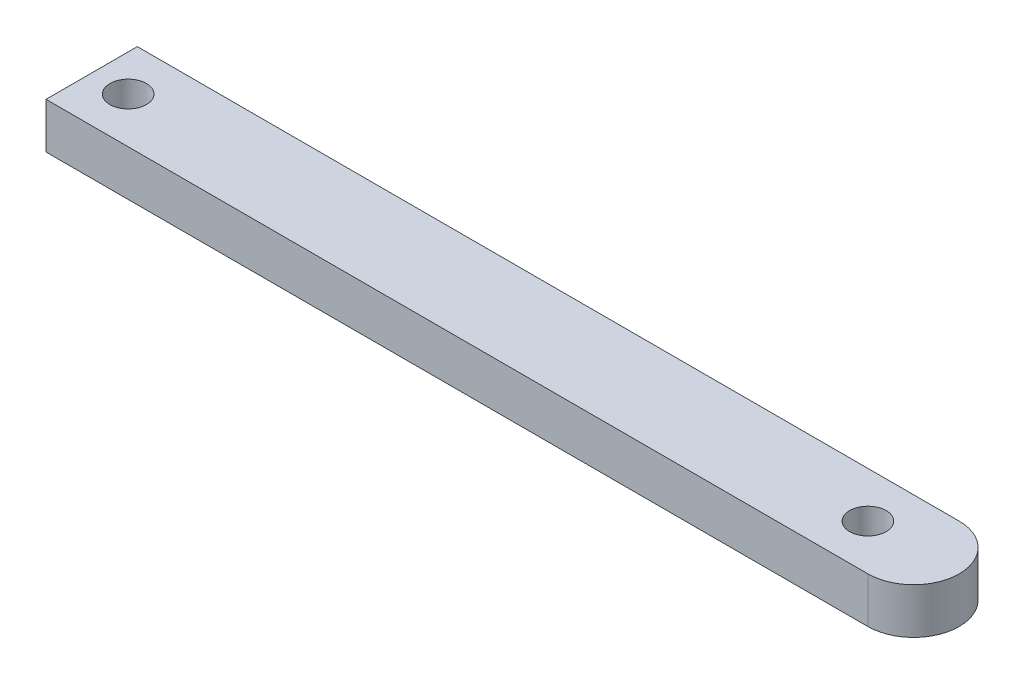
from build123d import *

# Parameters (mm, degrees)
SKETCH1_R           = 2
BOSS_EXTRUDE1_DEPTH = 5


with BuildPart() as part:
    # Sketch1 → Boss-Extrude1 (new body)
    with BuildSketch(Plane(origin=(0, 0, 0), x_dir=(1, 0, 0), z_dir=(0, 1, 0))):
        with BuildLine():
            Line((0, 5), (0, 0))
            Line((0, 0), (90, 0))
            ThreePointArc((90, 0), (95, 5), (90, 10))
            Line((90, 10), (0, 10))
            Line((0, 10), (0, 5))
        make_face()
        with Locations((4, 5)):
            Circle(SKETCH1_R, mode=Mode.SUBTRACT)
        with Locations((85, 5)):
            Circle(SKETCH1_R, mode=Mode.SUBTRACT)
    extrude(amount=BOSS_EXTRUDE1_DEPTH)


solid = part.part
